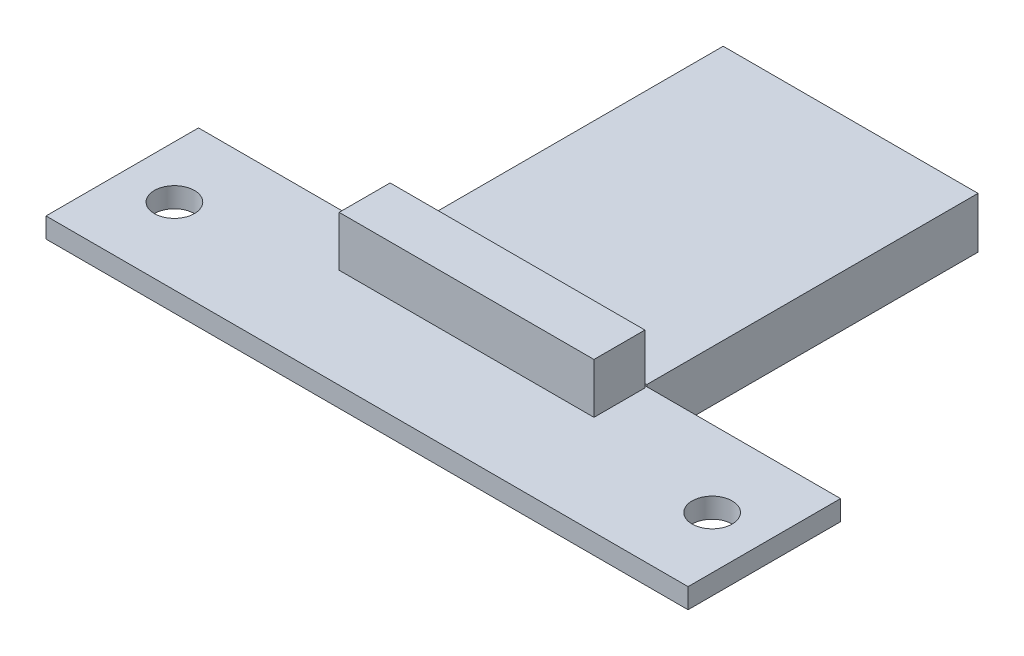
from build123d import *

# Parameters (mm, degrees)
SKETCH1_W           = 32
SKETCH1_H           = 7.6
BOSS_EXTRUDE1_DEPTH = 1
SKETCH2_R           = 1
CUT_EXTRUDE1_DEPTH  = 17.475436261
SKETCH3_W           = 1.6
SKETCH3_H           = 2.2
BOSS_EXTRUDE2_DEPTH = 1
SKETCH4_W           = 12.7
SKETCH4_H           = 2.54
BOSS_EXTRUDE3_DEPTH = 16.5
SKETCH5_W           = 12.7
SKETCH5_H           = 2.54
BOSS_EXTRUDE4_DEPTH = 2.5


with BuildPart() as part:
    # Sketch1 → Boss-Extrude1 (new body)
    with BuildSketch(Plane(origin=(0, 0, 0), x_dir=(1, 0, 0), z_dir=(0, 1, 0))):
        Rectangle(SKETCH1_W, SKETCH1_H)
    extrude(amount=BOSS_EXTRUDE1_DEPTH)

    # Sketch2 → Cut-Extrude1 (cut, through all)
    with BuildSketch(Plane(origin=(0, 1, 0), x_dir=(1, 0, 0), z_dir=(0, 1, 0))):
        with Locations((-13.4, 0)):
            Circle(SKETCH2_R)
        with Locations((13.4, 0)):
            Circle(SKETCH2_R)
    extrude(amount=-CUT_EXTRUDE1_DEPTH, mode=Mode.SUBTRACT)

    # Sketch3 → Boss-Extrude2 (add)
    with BuildSketch(Plane.XZ):
        with Locations((-9.5, 0)):
            Rectangle(SKETCH3_W, SKETCH3_H)
        with Locations((9.5, 0)):
            Rectangle(SKETCH3_W, SKETCH3_H)
        with Locations((0, 1.1)):
            Rectangle(SKETCH3_W, SKETCH3_H)
    extrude(amount=BOSS_EXTRUDE2_DEPTH)

    # Sketch4 → Boss-Extrude3 (add)
    with BuildSketch(Plane(origin=(0, 0, -3.8), x_dir=(-1, 0, 0), z_dir=(0, 0, -1))):
        with Locations((0, -0.17)):
            Rectangle(SKETCH4_W, SKETCH4_H)
    extrude(amount=BOSS_EXTRUDE3_DEPTH)

    # Sketch5 → Boss-Extrude4 (add)
    with BuildSketch(Plane(origin=(0, 1, 0), x_dir=(1, 0, 0), z_dir=(0, 1, 0))):
        with Locations((0, 2.43)):
            Rectangle(SKETCH5_W, SKETCH5_H)
    extrude(amount=BOSS_EXTRUDE4_DEPTH)


solid = part.part
